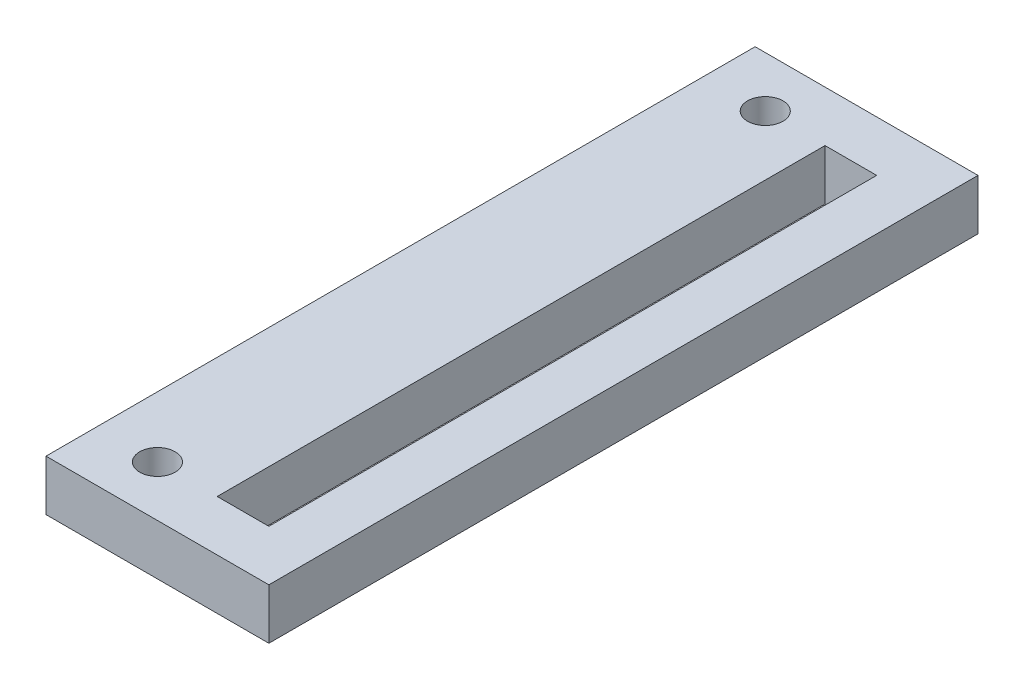
from build123d import *

# Parameters (mm, degrees)
SKETCH1_W           = 22
SKETCH1_H           = 70
SKETCH1_R           = 1.75
SKETCH1_W_2         = 5.1
SKETCH1_H_2         = 60
BOSS_EXTRUDE1_DEPTH = 5


with BuildPart() as part:
    # Sketch1 → Boss-Extrude1 (new body)
    with BuildSketch(Plane(origin=(0, 0, 0), x_dir=(1, 0, 0), z_dir=(0, 1, 0))):
        with Locations((11, 35)):
            Rectangle(SKETCH1_W, SKETCH1_H)
        with Locations((6, 65)):
            Circle(SKETCH1_R, mode=Mode.SUBTRACT)
        with Locations((6, 5)):
            Circle(SKETCH1_R, mode=Mode.SUBTRACT)
        with Locations((14.45, 35)):
            Rectangle(SKETCH1_W_2, SKETCH1_H_2, mode=Mode.SUBTRACT)
    extrude(amount=BOSS_EXTRUDE1_DEPTH)


solid = part.part
